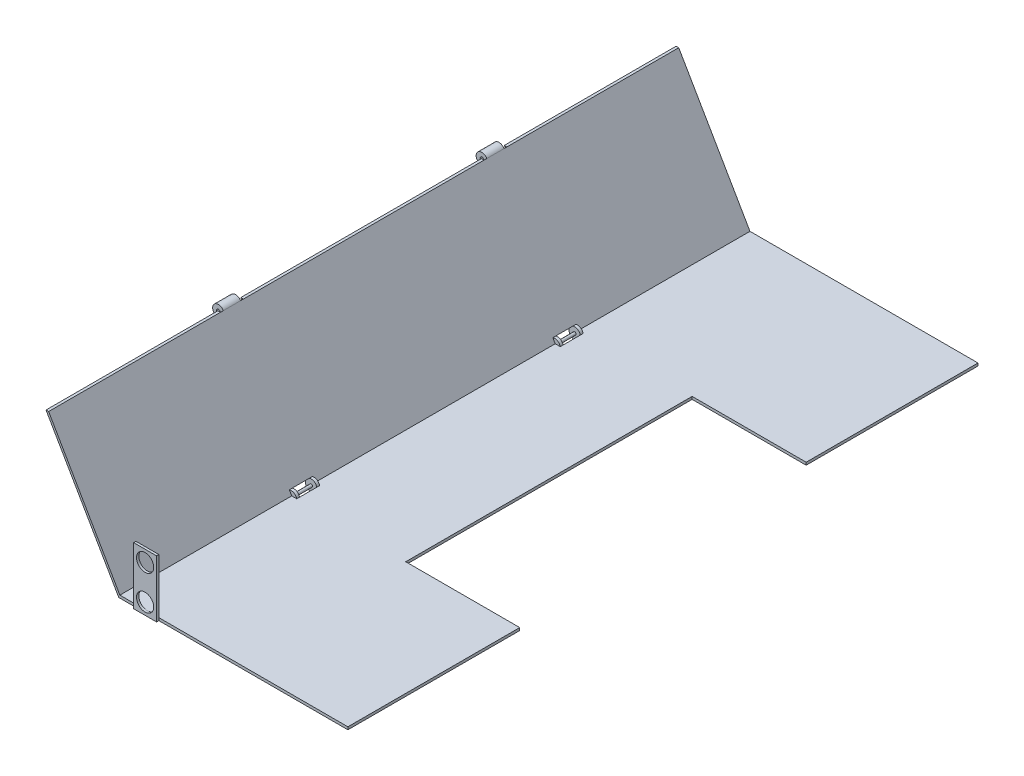
from build123d import *

# Parameters (mm, degrees)
BOSS_EXTRUDE1_DEPTH = 550
SKETCH2_W           = 99.516911358
SKETCH2_H           = 250
CUT_EXTRUDE1_DEPTH  = 596.064959308
SKETCH4_R           = 5
CUT_EXTRUDE2_DEPTH  = 20
SKETCH4_3_R         = 5
BOSS_EXTRUDE3_DEPTH = 2.5
BOSS_EXTRUDE4_START = 17.5
SKETCH4_5_R         = 5
BOSS_EXTRUDE4_DEPTH = 2.5
SKETCH4_7_R         = 1.240896304
BOSS_EXTRUDE5_DEPTH = 17.5
BOSS_EXTRUDE6_START = -150
SKETCH5_R           = 5
SKETCH5_R_2         = 1.5
BOSS_EXTRUDE6_DEPTH = 19.5
CUT_EXTRUDE5_START  = -167.5
SKETCH5_4_R         = 5
CUT_EXTRUDE5_DEPTH  = 2.5
CUT_EXTRUDE6_START  = -150
SKETCH5_6_R         = 5
CUT_EXTRUDE6_DEPTH  = 2.5
SKETCH7_W           = 20
SKETCH7_H           = 50
SKETCH7_R           = 7.5
BOSS_EXTRUDE7_DEPTH = 2


with BuildPart() as part:
    # Sketch1 → Boss-Extrude1 (new body)
    with BuildSketch(Plane.XY):
        Polygon((0, 0), (-63.508529611, 110), (-61.222529611, 110), (0.966177285, 2.286), (200, 2.286), (200, 0), align=None)
    extrude(amount=BOSS_EXTRUDE1_DEPTH)

    # Sketch2 → Cut-Extrude1 (cut, through all)
    with BuildSketch(Plane(origin=(0, 2.286, 0), x_dir=(1, 0, 0), z_dir=(0, 1, 0))):
        with Locations((150.241544321, -275)):
            Rectangle(SKETCH2_W, SKETCH2_H)
    extrude(amount=-CUT_EXTRUDE1_DEPTH, mode=Mode.SUBTRACT)

    # Sketch4 → Cut-Extrude2 (cut)
    with BuildSketch(Plane.XY.offset(150)):
        with Locations((0.483088642, 1.143)):
            Circle(SKETCH4_R)
    cut_extrude2 = extrude(amount=CUT_EXTRUDE2_DEPTH, mode=Mode.SUBTRACT)

    # Sketch4<3> → Boss-Extrude3 (add)
    with BuildSketch(Plane.XY.offset(150)):
        with Locations((0.483088642, 1.143)):
            Circle(SKETCH4_3_R)
    boss_extrude3 = extrude(amount=BOSS_EXTRUDE3_DEPTH)

    # Sketch4<5> → Boss-Extrude4 (add)
    with BuildSketch(Plane.XY.offset(150).offset(BOSS_EXTRUDE4_START)):
        with Locations((0.483088642, 1.143)):
            Circle(SKETCH4_5_R)
    boss_extrude4 = extrude(amount=BOSS_EXTRUDE4_DEPTH)

    # Sketch4<7> → Boss-Extrude5 (add)
    with BuildSketch(Plane.XY.offset(150)):
        with Locations((0.483088642, 1.143)):
            Circle(SKETCH4_7_R)
    boss_extrude5 = extrude(amount=BOSS_EXTRUDE5_DEPTH)

    # Mirror1: Cut-Extrude2, Boss-Extrude3, Boss-Extrude4, Boss-Extrude5 across plane
    add(cut_extrude2.mirror(Plane.XY.offset(275)), mode=Mode.SUBTRACT)
    add(boss_extrude3.mirror(Plane.XY.offset(275)))
    add(boss_extrude4.mirror(Plane.XY.offset(275)))
    add(boss_extrude5.mirror(Plane.XY.offset(275)))

    # Sketch5 → Boss-Extrude6 (add)
    with BuildSketch(Plane.XY.offset(550).offset(BOSS_EXTRUDE6_START)):
        with Locations((-65.55265663, 107.5)):
            Circle(SKETCH5_R)
        with Locations((-65.55265663, 107.5)):
            Circle(SKETCH5_R_2, mode=Mode.SUBTRACT)
    boss_extrude6 = extrude(amount=-BOSS_EXTRUDE6_DEPTH)

    # Sketch5<4> → Cut-Extrude5 (cut)
    with BuildSketch(Plane.XY.offset(550).offset(CUT_EXTRUDE5_START)):
        with Locations((-65.55265663, 107.5)):
            Circle(SKETCH5_4_R)
    cut_extrude5 = extrude(amount=-CUT_EXTRUDE5_DEPTH, mode=Mode.SUBTRACT)

    # Sketch5<6> → Cut-Extrude6 (cut)
    with BuildSketch(Plane.XY.offset(550).offset(CUT_EXTRUDE6_START)):
        with Locations((-65.55265663, 107.5)):
            Circle(SKETCH5_6_R)
    cut_extrude6 = extrude(amount=-CUT_EXTRUDE6_DEPTH, mode=Mode.SUBTRACT)

    # Mirror2: Boss-Extrude6, Cut-Extrude5, Cut-Extrude6 across plane
    add(boss_extrude6.mirror(Plane.XY.offset(275)))
    add(cut_extrude5.mirror(Plane.XY.offset(275)), mode=Mode.SUBTRACT)
    add(cut_extrude6.mirror(Plane.XY.offset(275)), mode=Mode.SUBTRACT)

    # Sketch7 → Boss-Extrude7 (add)
    with BuildSketch(Plane.XY.offset(550)):
        with Locations((25, 25)):
            Rectangle(SKETCH7_W, SKETCH7_H)
        with Locations((25, 10)):
            Circle(SKETCH7_R, mode=Mode.SUBTRACT)
        with Locations((25, 40)):
            Circle(SKETCH7_R, mode=Mode.SUBTRACT)
    extrude(amount=BOSS_EXTRUDE7_DEPTH)


solid = part.part
